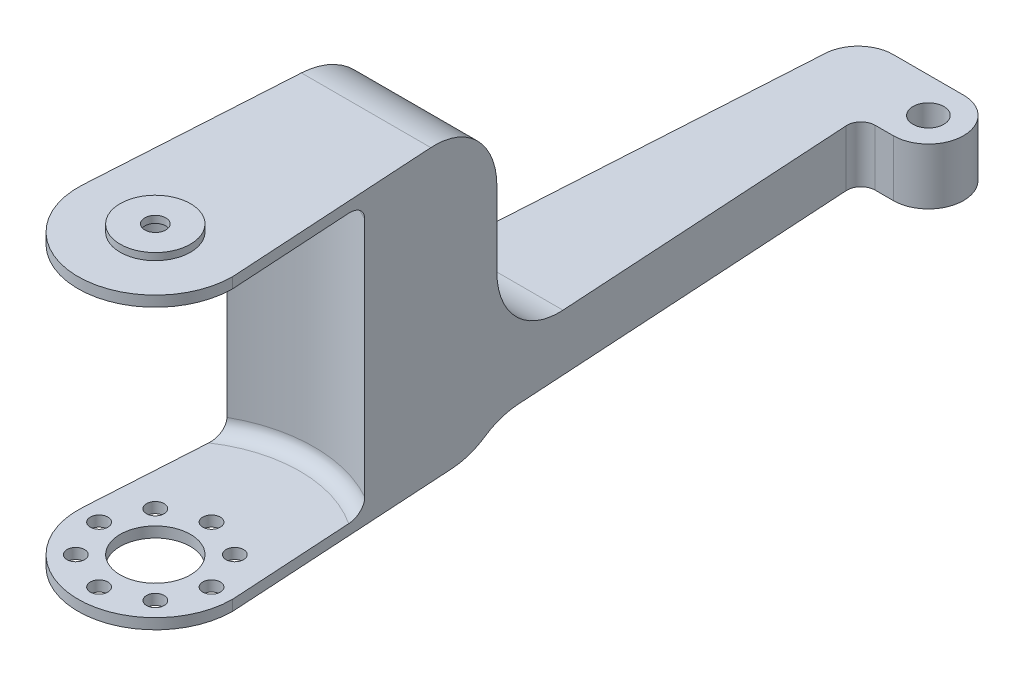
from build123d import *

# Parameters (mm, degrees)
SKETCH3_R           = 4.249999999999999
SKETCH3_R_2         = 2.1999999999999984
BOSS_EXTRUDE2_DEPTH = 1.5
SKETCH3_18_R        = 5
SKETCH3_18_R_2      = 1.5
BOSS_EXTRUDE3_DEPTH = 1
SKETCH3_19_R        = 4.249999999999999
SKETCH3_19_R_2      = 3.250000000000001
BOSS_EXTRUDE4_DEPTH = 2.5
BOSS_EXTRUDE5_START = 39.75
SKETCH3_20_R        = 5
SKETCH3_20_R_2      = 1.2500000000000002
SKETCH3_20_R_3      = 1.2499999999999998
SKETCH3_20_R_4      = 1.2499999999999991
SKETCH3_20_R_5      = 1.2500000000000004
SKETCH3_20_R_6      = 2.1999999999999984
BOSS_EXTRUDE5_DEPTH = 1.5
SKETCH3_21_R        = 2.1999999999999984
BOSS_EXTRUDE6_DEPTH = 41.25
SKETCH3_23_R        = 2.1999999999999984
CUT_EXTRUDE7_DEPTH  = 30.63
CUT_EXTRUDE8_START  = 38.63
SKETCH3_24_R        = 2.1999999999999984
CUT_EXTRUDE8_DEPTH  = 2.62
FILLET5_R           = 10
FILLET6_R           = 10
FILLET7_R           = 2


with BuildPart() as part:
    # Sketch3 → Boss-Extrude2 (new body)
    with BuildSketch(Plane(origin=(0, 0, 0), x_dir=(-1, 0, 0), z_dir=(0, -1, 0))):
        with BuildLine():
            Line((5.000000000000005, 100), (10.980122362164348, 0.6609938818917814))
            ThreePointArc((10.980122362164348, 0.6609938818917814), (0.3306463489834291, -10.995029467532314), (-11, 0))
            Line((-11, 0), (-5.300000000000002, 95.00000000000001))
            Line((-5.300000000000002, 95.00000000000001), (-9.999999999999998, 95.00000000000003))
            ThreePointArc((-9.999999999999998, 95.00000000000003), (-15.00000000000001, 100.00000000000003), (-9.999999999999996, 105.00000000000004))
            Line((-9.999999999999996, 105.00000000000004), (5.6e-16, 105.00000000000003))
            ThreePointArc((5.6e-16, 105.00000000000003), (3.5355339059327497, 103.53553390593275), (5.000000000000005, 100))
        make_face()
        with Locations(Location((0, 0, 0), (0, 0, 270))):
            Circle(SKETCH3_R, mode=Mode.SUBTRACT)
        with Locations(Location((-9.999999999999998, 100.00000000000003, 0), (0, 0, 270))):
            Circle(SKETCH3_R_2, mode=Mode.SUBTRACT)
    extrude(amount=BOSS_EXTRUDE2_DEPTH)

    # Sketch3<18> → Boss-Extrude3 (add)
    with BuildSketch(Plane(origin=(0, 0, 0), x_dir=(-1, 0, 0), z_dir=(0, -1, 0))):
        with Locations(Location((0, 0, 0), (0, 0, 270))):
            Circle(SKETCH3_18_R)
        with Locations(Location((0, 0, 0), (0, 0, 270))):
            Circle(SKETCH3_18_R_2, mode=Mode.SUBTRACT)
    extrude(amount=-BOSS_EXTRUDE3_DEPTH)

    # Sketch3<19> → Boss-Extrude4 (add)
    with BuildSketch(Plane(origin=(0, 0, 0), x_dir=(-1, 0, 0), z_dir=(0, -1, 0))):
        with Locations(Location((0, 0, 0), (0, 0, 270))):
            Circle(SKETCH3_19_R)
        with Locations(Location((0, 0, 0), (0, 0, 270))):
            Circle(SKETCH3_19_R_2, mode=Mode.SUBTRACT)
    extrude(amount=BOSS_EXTRUDE4_DEPTH)



with BuildPart() as body_2:
    # Sketch3<20> → Boss-Extrude5 (new body)
    with BuildSketch(Plane(origin=(0, 0, 0), x_dir=(-1, 0, 0), z_dir=(0, -1, 0)).offset(BOSS_EXTRUDE5_START)):
        with BuildLine():
            Line((5.000000000000005, 100), (10.980122362164348, 0.6609938818917814))
            ThreePointArc((10.980122362164348, 0.6609938818917814), (0.3306463489834291, -10.995029467532314), (-11, 0))
            Line((-11, 0), (-5.300000000000002, 95.00000000000001))
            Line((-5.300000000000002, 95.00000000000001), (-9.999999999999998, 95.00000000000003))
            ThreePointArc((-9.999999999999998, 95.00000000000003), (-15.00000000000001, 100.00000000000003), (-9.999999999999996, 105.00000000000004))
            Line((-9.999999999999996, 105.00000000000004), (5.6e-16, 105.00000000000003))
            ThreePointArc((5.6e-16, 105.00000000000003), (3.5355339059327497, 103.53553390593275), (5.000000000000005, 100))
        make_face()
        with Locations(Location((0, 0, 0), (0, 0, 270))):
            Circle(SKETCH3_20_R, mode=Mode.SUBTRACT)
        with Locations(Location((-8, 0, 0), (0, 0, 270))):
            Circle(SKETCH3_20_R_2, mode=Mode.SUBTRACT)
        with Locations(Location((-5.65685424949238, 5.656854249492384, 0), (0, 0, 270))):
            Circle(SKETCH3_20_R_2, mode=Mode.SUBTRACT)
        with Locations(Location((0, 8.000000000000007, 0), (0, 0, 270))):
            Circle(SKETCH3_20_R_3, mode=Mode.SUBTRACT)
        with Locations(Location((5.656854249492385, 5.656854249492391, 0), (0, 0, 270))):
            Circle(SKETCH3_20_R_2, mode=Mode.SUBTRACT)
        with Locations(Location((8.000000000000009, 9.11e-15, 0), (0, 0, 270))):
            Circle(SKETCH3_20_R_4, mode=Mode.SUBTRACT)
        with Locations(Location((5.656854249492392, -5.656854249492377, 0), (0, 0, 270))):
            Circle(SKETCH3_20_R_2, mode=Mode.SUBTRACT)
        with Locations(Location((1.019e-14, -8, 0), (0, 0, 270))):
            Circle(SKETCH3_20_R_5, mode=Mode.SUBTRACT)
        with Locations(Location((-5.656854249492376, -5.656854249492382, 0), (0, 0, 270))):
            Circle(SKETCH3_20_R_2, mode=Mode.SUBTRACT)
        with Locations(Location((-9.999999999999998, 100.00000000000003, 0), (0, 0, 270))):
            Circle(SKETCH3_20_R_6, mode=Mode.SUBTRACT)
    extrude(amount=BOSS_EXTRUDE5_DEPTH)


with BuildPart() as part_1:
    add(part.part)

    add(body_2.part)  # Boss-Extrude6 merges body 2
    # Sketch3<21> → Boss-Extrude6 (add)
    with BuildSketch(Plane(origin=(0, 0, 0), x_dir=(-1, 0, 0), z_dir=(0, -1, 0))):
        with BuildLine():
            ThreePointArc((5.000000000000007, 100), (3.5355339059327426, 103.53553390593274), (6e-17, 105))
            Line((0, 105.00000000000003), (-9.999999999999996, 105.00000000000004))
            ThreePointArc((-9.999999999999996, 105.00000000000003), (-15.000000000000014, 100.00000000000003), (-9.999999999999998, 95.00000000000003))
            Line((-9.999999999999998, 95.00000000000003), (-5.300000000000002, 95.00000000000001))
            Line((-5.300000000000002, 95.00000000000001), (-9.800000000000002, 20))
            ThreePointArc((-9.800000000000002, 20), (0.00796544916277364, 22.5700311604401), (9.815930898325552, 19.999999999999996))
            Line((9.815930898325552, 19.999999999999996), (5.000000000000004, 100))
        make_face()
        with Locations(Location((-9.999999999999998, 100.00000000000003, 0), (0, 0, 270))):
            Circle(SKETCH3_21_R, mode=Mode.SUBTRACT)
    extrude(amount=BOSS_EXTRUDE6_DEPTH)

    # Sketch3<23> → Cut-Extrude7 (cut)
    with BuildSketch(Plane(origin=(0, 0, 0), x_dir=(-1, 0, 0), z_dir=(0, -1, 0))):
        with BuildLine():
            Line((8.611948173744162, 40), (5.000000000000005, 100))
            ThreePointArc((5.000000000000002, 100), (3.5355339059327484, 103.53553390593275), (5.6e-16, 105.00000000000003))
            Line((0, 105.00000000000003), (-9.999999999999996, 105.00000000000004))
            ThreePointArc((-9.999999999999996, 105.00000000000003), (-15.000000000000014, 100.00000000000003), (-9.999999999999998, 95.00000000000003))
            Line((-9.999999999999998, 95.00000000000003), (-5.300000000000002, 95.00000000000001))
            Line((-5.300000000000002, 95.00000000000001), (-8.600000000000001, 40.00000000000001))
            Line((-8.600000000000003, 40), (8.611948173744162, 40))
        make_face()
        with Locations(Location((-9.999999999999998, 100.00000000000003, 0), (0, 0, 270))):
            Circle(SKETCH3_23_R, mode=Mode.SUBTRACT)
    extrude(amount=CUT_EXTRUDE7_DEPTH, mode=Mode.SUBTRACT)

    # Sketch3<24> → Cut-Extrude8 (cut)
    with BuildSketch(Plane(origin=(0, 0, 0), x_dir=(-1, 0, 0), z_dir=(0, -1, 0)).offset(CUT_EXTRUDE8_START)):
        with BuildLine():
            Line((8.611948173744162, 40), (5.000000000000005, 100))
            ThreePointArc((5.000000000000002, 100), (3.5355339059327484, 103.53553390593275), (5.6e-16, 105.00000000000003))
            Line((0, 105.00000000000003), (-9.999999999999996, 105.00000000000004))
            ThreePointArc((-9.999999999999996, 105.00000000000003), (-15.000000000000014, 100.00000000000003), (-9.999999999999998, 95.00000000000003))
            Line((-9.999999999999998, 95.00000000000003), (-5.300000000000002, 95.00000000000001))
            Line((-5.300000000000002, 95.00000000000001), (-8.600000000000001, 40.00000000000001))
            Line((-8.600000000000003, 40), (8.611948173744162, 40))
        make_face()
        with Locations(Location((-9.999999999999998, 100.00000000000003, 0), (0, 0, 270))):
            Circle(SKETCH3_24_R, mode=Mode.SUBTRACT)
    extrude(amount=CUT_EXTRUDE8_DEPTH, mode=Mode.SUBTRACT)

    # Fillet5
    # the kernel refuses this fillet: 10 mm, written as the material it takes off along each edge
    with BuildSketch(Plane(origin=(33.6, 0, -40), x_dir=(0, -1, 0), z_dir=(-1, 0, 0))) as fillet5_piece_1:
        with BuildLine():
            CenterArc((FILLET5_R, FILLET5_R), FILLET5_R, 180, 90)
            Line((-1.78e-15, FILLET5_R), (-FILLET5_R * 0.02, FILLET5_R))
            Line((-FILLET5_R * 0.02, FILLET5_R), (-FILLET5_R * 0.02, -FILLET5_R * 0.02))
            Line((-FILLET5_R * 0.02, -FILLET5_R * 0.02), (FILLET5_R, -FILLET5_R * 0.02))
            Line((FILLET5_R, -FILLET5_R * 0.02), (FILLET5_R, 0))
        make_face()
    extrude(amount=67.21194817374416, mode=Mode.SUBTRACT)
    with BuildSketch(Plane(origin=(25.470017783037456, -41.25, -40), x_dir=(0, 1, 0), z_dir=(-1, 0, 0))) as fillet5_piece_2:
        with BuildLine():
            CenterArc((10, -6.748007113214982), FILLET5_R, 137.5613237933639, 42.4386762066361)
            Line((0, -6.748007113214982), (-0.20000000000000284, -6.748007113214982))
            Line((-0.20000000000000284, -6.748007113214982), (-0.20000000000000284, 0))
            Line((-0.20000000000000284, 0), (0, 0.20000000000000284))
            ThreePointArc((0, 0.20000000000000284), (1.3100000000000023, 0.20000000000000284), (2.4724000000000004, 0.13496014226429764))
            Line((2.4724000000000004, 0.13496014226429764), (2.6199999999999974, 0))
        make_face()
    extrude(amount=50.95198373981907, mode=Mode.SUBTRACT)

    # Fillet6
    fillet6_edges = [part_1.edges().sort_by_distance(p)[0] for p in [
        (-0.00597408687207945, -30.63, -40),
        (-0.00597408687207945, -38.63, -40),
    ]]
    fillet(fillet6_edges, radius=FILLET6_R)

    # Fillet7
    fillet7_edges = [part_1.edges().sort_by_distance(p)[0] for p in [
        (5.300000000000002, -34.63, -95.00000000000001),
        (-0.00796544916277897, -1.5, -22.570031160440095),
        (-0.00796544916277897, -39.75, -22.570031160440095),
    ]]
    fillet(fillet7_edges, radius=FILLET7_R)


solid = part_1.part
